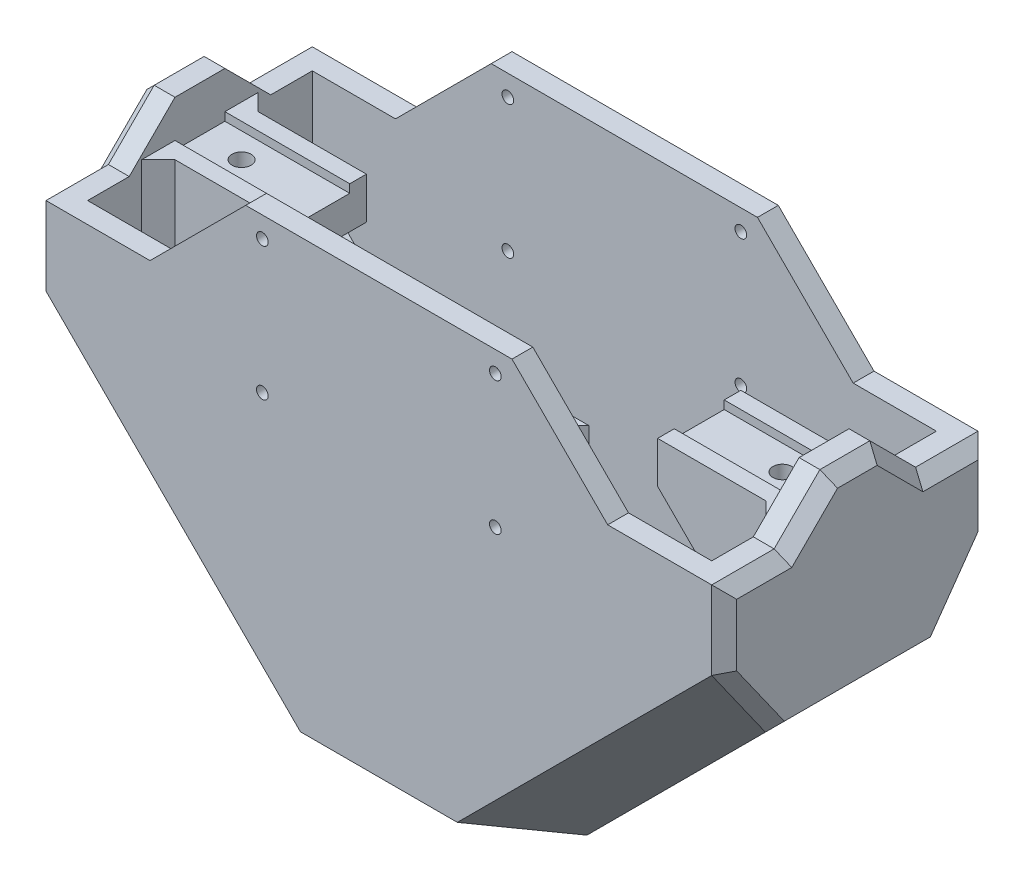
from build123d import *

# Parameters (mm, degrees)
SKETCH1_W                  = 150
SKETCH1_H                  = 54
BOSS_EXTRUDE1_DEPTH        = 75
SHELL1_T                   = 5
BOSS_EXTRUDE2_DEPTH        = 5
BOSS_EXTRUDE3_DEPTH        = 5
SKETCH3_R                  = 1.4
CUT_EXTRUDE1_DEPTH         = 6
BOSS_EXTRUDE4_DEPTH        = 10
SKETCH9_W                  = 30
SKETCH9_H                  = 20
BOSS_EXTRUDE6_DEPTH        = 2
CUT_EXTRUDE2_REACH         = 188.153
SKETCH10_W                 = 12
SKETCH10_H                 = 2
SKETCH11_R                 = 2.3
CUT_EXTRUDE3_DEPTH         = 6
SKETCH13_W                 = 10.5
SKETCH13_H                 = 15
BOSS_EXTRUDE8_DEPTH        = 27
BOSS_EXTRUDE9_DEPTH        = 3.2
CUT_EXTRUDE4_REACH         = 111.024
SKETCH15_R                 = 1.4
CHAMFER8_SIZE              = 0.5
CHAMFER8_OF_MIRROR6_SIZE   = 0.5
CHAMFER3_SIZE              = 40
CHAMFER5_SIZE              = 42.9
CHAMFER9_SIZE              = 5
CHAMFER10_SIZE             = 2
CHAMFER11_SIZE             = 10
CHAMFER12_SIZE             = 12.9
CHAMFER13_SIZE             = 4
BOSS_EXTRUDE10_DEPTH       = 3
CHAMFER14_SIZE             = 3
CHAMFER14_OF_MIRROR28_SIZE = 3


# Some blends are built 0.0001 mm under size
with BuildPart() as part:
    # Sketch1 → Boss-Extrude1 (new body)
    with BuildSketch(Plane(origin=(0, 0, 0), x_dir=(1, 0, 0), z_dir=(0, 1, 0))):
        Rectangle(SKETCH1_W, SKETCH1_H)
    extrude(amount=BOSS_EXTRUDE1_DEPTH)

    # Shell1
    shell1_openings = [part.faces().sort_by_distance(p)[0] for p in [
        (0, 75, 0),
    ]]
    offset(amount=SHELL1_T, openings=shell1_openings, kind=Kind.INTERSECTION)

    # Sketch2 → Boss-Extrude2 (add)
    with BuildSketch(Plane(origin=(80, 0, 0), x_dir=(0, 0, -1), z_dir=(1, 0, 0))):
        Polygon((-17, 75), (-6, 86), (6, 86), (17, 75), align=None)
    boss_extrude2 = extrude(amount=-BOSS_EXTRUDE2_DEPTH)

    # Sketch4 → Boss-Extrude3 (add)
    with BuildSketch(Plane(origin=(0, 0, -32), x_dir=(-1, 0, 0), z_dir=(0, 0, -1))):
        Polygon((-55, 75), (-32, 98), (32, 98), (55, 75), align=None)
    boss_extrude3 = extrude(amount=-BOSS_EXTRUDE3_DEPTH)

    # Sketch3 → Cut-Extrude1 (cut)
    with BuildSketch(Plane(origin=(0, 0, -32), x_dir=(-1, 0, 0), z_dir=(0, 0, -1))):
        with Locations((-28, 93)):
            Circle(SKETCH3_R)
        with Locations((-28, 61)):
            Circle(SKETCH3_R)
        with Locations((28, 93)):
            Circle(SKETCH3_R)
        with Locations((28, 61)):
            Circle(SKETCH3_R)
    cut_extrude1 = extrude(amount=-CUT_EXTRUDE1_DEPTH, mode=Mode.SUBTRACT)

    # Mirror4: Boss-Extrude3, Cut-Extrude1 across plane
    add(boss_extrude3.mirror(Plane.XY))
    add(cut_extrude1.mirror(Plane.XY), mode=Mode.SUBTRACT)

    # Mirror5: Boss-Extrude2 across plane
    add(boss_extrude2.mirror(Plane(origin=(0, 0, 0), x_dir=(0, 0, 1), z_dir=(1, 0, 0))))

    # Sketch5 → Boss-Extrude4 (add, symmetric)
    with BuildSketch(Plane.XY):
        Polygon((-75, 75), (-45, 75), (-45, 67), (-75, 37), align=None)
    boss_extrude4 = extrude(amount=BOSS_EXTRUDE4_DEPTH, both=True)

    # Sketch9 → Boss-Extrude6 (add)
    with BuildSketch(Plane(origin=(0, 75, 0), x_dir=(1, 0, 0), z_dir=(0, 1, 0))):
        with Locations((-60, 0)):
            Rectangle(SKETCH9_W, SKETCH9_H)
    boss_extrude6 = extrude(amount=BOSS_EXTRUDE6_DEPTH)

    # Sketch10 → Cut-Extrude2 (cut, up to next)
    with BuildSketch(Plane(origin=(-75, 0, 0), x_dir=(0, 0, -1), z_dir=(1, 0, 0)), mode=Mode.PRIVATE) as cut_extrude2_sk1:
        with Locations((0, 76)):
            Rectangle(SKETCH10_W, SKETCH10_H)
    cut_extrude2_tool1 = extrude(cut_extrude2_sk1.sketch, amount=CUT_EXTRUDE2_REACH, mode=Mode.PRIVATE) & part.part
    cut_extrude2 = cut_extrude2_tool1.solids().sort_by_distance((-75, 76, 0))[0]
    add(cut_extrude2, mode=Mode.SUBTRACT)

    # Sketch11 → Cut-Extrude3 (cut)
    with BuildSketch(Plane(origin=(0, 75, 0), x_dir=(1, 0, 0), z_dir=(0, 1, 0))):
        with Locations(Location((-65, 0, 0), (0, 0, 270))):
            Circle(SKETCH11_R)
    cut_extrude3 = extrude(amount=-CUT_EXTRUDE3_DEPTH, mode=Mode.SUBTRACT)

    # Mirror24: Boss-Extrude4, Boss-Extrude6, Cut-Extrude2, Cut-Extrude3 across plane
    add(boss_extrude4.mirror(Plane(origin=(0, 0, 0), x_dir=(0, 0, 1), z_dir=(1, 0, 0))))
    add(boss_extrude6.mirror(Plane(origin=(0, 0, 0), x_dir=(0, 0, 1), z_dir=(1, 0, 0))))
    add(cut_extrude2.mirror(Plane(origin=(0, 0, 0), x_dir=(0, 0, 1), z_dir=(1, 0, 0))), mode=Mode.SUBTRACT)
    add(cut_extrude3.mirror(Plane(origin=(0, 0, 0), x_dir=(0, 0, 1), z_dir=(1, 0, 0))), mode=Mode.SUBTRACT)

    # Sketch13 → Boss-Extrude8 (add, symmetric)
    with BuildSketch(Plane.XY):
        with Locations((35.75, 23.7)):
            Rectangle(SKETCH13_W, SKETCH13_H)
        with Locations((-15.75, 23.7)):
            Rectangle(SKETCH13_W, SKETCH13_H)
    extrude(amount=BOSS_EXTRUDE8_DEPTH, both=True)

    # Sketch14 → Boss-Extrude9 (add)
    with BuildSketch(Plane(origin=(0, 31.2, 0), x_dir=(1, 0, 0), z_dir=(0, 1, 0))):
        with BuildLine():
            Line((-10.5, -27), (-10.5, -9.6))
            Line((-10.5, -9.6), (-15.5, -9.6))
            ThreePointArc((-15.5, -9.6), (-16.914213562, -9.014213562), (-17.5, -7.6))
            Line((-17.5, -7.6), (-17.5, 7.6))
            ThreePointArc((-17.5, 7.6), (-16.914213562, 9.014213562), (-15.5, 9.6))
            Line((-15.5, 9.6), (-10.5, 9.6))
            Line((-10.5, 9.6), (-10.5, 27))
            Line((-10.5, 27), (-21, 27))
            Line((-21, 27), (-21, -27))
            Line((-21, -27), (-10.5, -27))
        make_face()
    boss_extrude9 = extrude(amount=BOSS_EXTRUDE9_DEPTH)

    # Sketch15 → Cut-Extrude4 (cut, up to next)
    with BuildSketch(Plane(origin=(0, 31.2, 0), x_dir=(1, 0, 0), z_dir=(0, 1, 0)), mode=Mode.PRIVATE) as cut_extrude4_sk1:
        with Locations(Location((-14.8, 5, 0), (0, 0, 180))):
            Circle(SKETCH15_R)
    cut_extrude4_tool1 = extrude(cut_extrude4_sk1.sketch, amount=-CUT_EXTRUDE4_REACH, mode=Mode.PRIVATE) & part.part
    # Sketch15 → Cut-Extrude4 (cut, up to next)
    with BuildSketch(Plane(origin=(0, 31.2, 0), x_dir=(1, 0, 0), z_dir=(0, 1, 0)), mode=Mode.PRIVATE) as cut_extrude4_sk2:
        with Locations(Location((-14.8, -5, 0), (0, 0, 180))):
            Circle(SKETCH15_R)
    cut_extrude4_tool2 = extrude(cut_extrude4_sk2.sketch, amount=-CUT_EXTRUDE4_REACH, mode=Mode.PRIVATE) & part.part
    cut_extrude4_1 = cut_extrude4_tool1.solids().sort_by_distance((-14.8, 31.2, -5))[0]
    add(cut_extrude4_1, mode=Mode.SUBTRACT)
    cut_extrude4_2 = cut_extrude4_tool2.solids().sort_by_distance((-14.8, 31.2, 5))[0]
    add(cut_extrude4_2, mode=Mode.SUBTRACT)
    cut_extrude4 = cut_extrude4_1 + cut_extrude4_2  # Cut-Extrude4 as one shape, for the pattern or mirror that repeats it

    # Chamfer8
    chamfer8_edges = [part.edges().sort_by_distance(p)[0] for p in [
        (-13.4, 31.2, -5),
        (-13.4, 31.2, 5),
    ]]
    chamfer(chamfer8_edges, length=CHAMFER8_SIZE)

    # Mirror6: Boss-Extrude9, Cut-Extrude4 across plane
    add(boss_extrude9.mirror(Plane(origin=(10, 0, 0), x_dir=(0, 0, 1), z_dir=(1, 0, 0))))
    add(cut_extrude4.mirror(Plane(origin=(10, 0, 0), x_dir=(0, 0, 1), z_dir=(1, 0, 0))), mode=Mode.SUBTRACT)

    # Chamfer8 of Mirror6
    chamfer8_of_mirror6_edges = [part.edges().sort_by_distance(p)[0] for p in [
        (33.4, 31.2, -5),
        (33.4, 31.2, 5),
    ]]
    chamfer(chamfer8_of_mirror6_edges, length=CHAMFER8_OF_MIRROR6_SIZE)

    # Chamfer3
    # the kernel refuses this chamfer: 40 mm, written as the material it adds along each edge
    with BuildSketch(Plane(origin=(75, 0, 27), x_dir=(0.027495876610586317, 0.9996219169112968, 0), z_dir=(0, 0, -1)), Plane(origin=(-75, 0, -27), x_dir=(-0.027495876610586317, 0.9996219169112968, 0), z_dir=(0, 0, 1))) as chamfer3_piece_1:
        Polygon((CHAMFER3_SIZE * 0.999621916911, -CHAMFER3_SIZE * 0.0274958766106), (-CHAMFER3_SIZE * 0.0274958766106, -CHAMFER3_SIZE * 0.999621916911), (0, 0), align=None)
    extrude(amount=54)

    # Chamfer5
    chamfer5_edges = [part.edges().sort_by_distance(p)[0] for p in [
        (-80, -5, 0),
        (80, -5, 0),
    ]]
    chamfer(chamfer5_edges, length=CHAMFER5_SIZE)

    # Chamfer9
    chamfer9_edges = [part.edges().sort_by_distance(p)[0] for p in [
        (35.75, 16.2, -27),
        (35.75, 16.2, 27),
        (-15.75, 16.2, -27),
        (-15.75, 16.2, 27),
    ]]
    chamfer(chamfer9_edges, length=CHAMFER9_SIZE)

    # Chamfer10
    chamfer10_edges = [part.edges().sort_by_distance(p)[0] for p in [
        (30.5, 22.8, -27),
        (41, 22.8, -27),
        (30.5, 22.8, 27),
        (41, 22.8, 27),
        (-10.5, 22.8, 27),
        (-21, 22.8, 27),
        (-10.5, 22.8, -27),
        (-21, 22.8, -27),
    ]]
    chamfer(chamfer10_edges, length=CHAMFER10_SIZE)

    # Chamfer11
    # the kernel refuses this chamfer: 10 mm, written as the material it adds along each edge
    with BuildSketch(Plane(origin=(93.184544799, 58.184544799, 27), x_dir=(-0.7068394360703909, 0.706839436070956, 0.027495876610586303), z_dir=(-0.7071067811868302, -0.7071067811862648, 0))) as chamfer11_piece_1_section:
        Polygon((CHAMFER11_SIZE * 0.999621916911, CHAMFER11_SIZE * 0.0274958766106), (-CHAMFER11_SIZE * 0.0274958766106, CHAMFER11_SIZE * 0.999621916911), (0, 0), align=None)
    chamfer11_piece_1 = extrude(amount=108.002202254, mode=Mode.PRIVATE)
    chamfer11_piece_1 = split(chamfer11_piece_1, bisect_by=Plane(origin=(75, 22.474171504, 23.809556955), z_dir=(-1, 0, 0)), keep=Keep.TOP, mode=Mode.PRIVATE)
    chamfer11_piece_1 = split(chamfer11_piece_1, bisect_by=Plane(origin=(52.525828496, 0, 23.809556955), z_dir=(0, 1, 0)), keep=Keep.TOP, mode=Mode.PRIVATE)
    add(chamfer11_piece_1)
    with BuildSketch(Plane(origin=(93.184544799, 58.184544799, -27), x_dir=(-0.7068394360703909, 0.7068394360709561, -0.027495876610586348), z_dir=(-0.7071067811868302, -0.7071067811862648, 0))) as chamfer11_piece_2_section:
        Polygon((CHAMFER11_SIZE * 0.999621916911, -CHAMFER11_SIZE * 0.0274958766106), (-CHAMFER11_SIZE * 0.0274958766106, -CHAMFER11_SIZE * 0.999621916911), (0, 0), align=None)
    chamfer11_piece_2 = extrude(amount=108.002202254, mode=Mode.PRIVATE)
    chamfer11_piece_2 = split(chamfer11_piece_2, bisect_by=Plane(origin=(75, 22.474171504, -23.809556955), z_dir=(-1, 0, 0)), keep=Keep.TOP, mode=Mode.PRIVATE)
    chamfer11_piece_2 = split(chamfer11_piece_2, bisect_by=Plane(origin=(52.525828496, 0, -23.809556955), z_dir=(0, 1, 0)), keep=Keep.TOP, mode=Mode.PRIVATE)
    add(chamfer11_piece_2)
    with BuildSketch(Plane(origin=(-93.184544799, 58.184544799, -27), x_dir=(0.7068394360703909, 0.706839436070956, -0.027495876610586303), z_dir=(0.7071067811868302, -0.7071067811862648, 0))) as chamfer11_piece_3_section:
        Polygon((CHAMFER11_SIZE * 0.999621916911, CHAMFER11_SIZE * 0.0274958766106), (-CHAMFER11_SIZE * 0.0274958766106, CHAMFER11_SIZE * 0.999621916911), (0, 0), align=None)
    chamfer11_piece_3 = extrude(amount=108.002202254, mode=Mode.PRIVATE)
    chamfer11_piece_3 = split(chamfer11_piece_3, bisect_by=Plane(origin=(-75, 22.474171504, -23.809556955), z_dir=(1, 0, 0)), keep=Keep.TOP, mode=Mode.PRIVATE)
    chamfer11_piece_3 = split(chamfer11_piece_3, bisect_by=Plane(origin=(-52.525828496, 0, -23.809556955), z_dir=(0, 1, 0)), keep=Keep.TOP, mode=Mode.PRIVATE)
    add(chamfer11_piece_3)
    with BuildSketch(Plane(origin=(-93.184544799, 58.184544799, 27), x_dir=(0.7068394360703909, 0.7068394360709561, 0.027495876610586334), z_dir=(0.7071067811868302, -0.7071067811862648, 0))) as chamfer11_piece_4_section:
        Polygon((CHAMFER11_SIZE * 0.999621916911, -CHAMFER11_SIZE * 0.0274958766106), (-CHAMFER11_SIZE * 0.0274958766106, -CHAMFER11_SIZE * 0.999621916911), (0, 0), align=None)
    chamfer11_piece_4 = extrude(amount=108.002202254, mode=Mode.PRIVATE)
    chamfer11_piece_4 = split(chamfer11_piece_4, bisect_by=Plane(origin=(-75, 22.474171504, 23.809556955), z_dir=(1, 0, 0)), keep=Keep.TOP, mode=Mode.PRIVATE)
    chamfer11_piece_4 = split(chamfer11_piece_4, bisect_by=Plane(origin=(-52.525828496, 0, 23.809556955), z_dir=(0, 1, 0)), keep=Keep.TOP, mode=Mode.PRIVATE)
    add(chamfer11_piece_4)

    # Chamfer12
    chamfer12_edges = [part.edges().sort_by_distance(p)[0] for p in [
        (-58.55, 16.45, -32),
        (58.55, 16.45, -32),
        (-58.55, 16.45, 32),
        (58.55, 16.45, 32),
    ]]
    chamfer(chamfer12_edges, length=CHAMFER12_SIZE)

    # Chamfer13
    # the kernel refuses this chamfer: 4 mm, written as the material it adds along each edge
    with BuildSketch(Plane(origin=(-75, 29.713268048, 10), x_dir=(-0.027495876610585623, 0, 0.9996219169112968), z_dir=(0, 1, 0))) as chamfer13_piece_1_section:
        Polygon((CHAMFER13_SIZE * 0.999621916911, CHAMFER13_SIZE * 0.0274958766106), (-CHAMFER13_SIZE * 0.0274958766106, CHAMFER13_SIZE * 0.999621916911), (0, 0), align=None)
    chamfer13_piece_1 = extrude(amount=47.286731952, mode=Mode.PRIVATE)
    chamfer13_piece_1 = split(chamfer13_piece_1, bisect_by=Plane(origin=(-63.755995162, 48.244004838, 11.33377678), z_dir=(-0.7071067811865515, 0.7071067811865436, 0)), keep=Keep.TOP, mode=Mode.PRIVATE)
    add(chamfer13_piece_1)
    with BuildSketch(Plane(origin=(-75, 77, -10), x_dir=(-0.027495876610737532, 0, -0.9996219169112927), z_dir=(0, -1, 0))) as chamfer13_piece_2_section:
        Polygon((CHAMFER13_SIZE * 0.999621916911, CHAMFER13_SIZE * 0.0274958766106), (-CHAMFER13_SIZE * 0.0274958766107, CHAMFER13_SIZE * 0.999621916911), (0, 0), align=None)
    chamfer13_piece_2 = extrude(amount=47.286731952, mode=Mode.PRIVATE)
    chamfer13_piece_2 = split(chamfer13_piece_2, bisect_by=Plane(origin=(-63.755995162, 48.244004838, -11.33377678), z_dir=(-0.7071067811865515, 0.7071067811865436, 0)), keep=Keep.TOP, mode=Mode.PRIVATE)
    add(chamfer13_piece_2)
    with BuildSketch(Plane(origin=(75, 77, 10), x_dir=(0.02749587661043717, 0, 0.9996219169113009), z_dir=(0, -1, 0))) as chamfer13_piece_3_section:
        Polygon((CHAMFER13_SIZE * 0.999621916911, CHAMFER13_SIZE * 0.0274958766106), (-CHAMFER13_SIZE * 0.0274958766104, CHAMFER13_SIZE * 0.999621916911), (0, 0), align=None)
    chamfer13_piece_3 = extrude(amount=47.286731952, mode=Mode.PRIVATE)
    chamfer13_piece_3 = split(chamfer13_piece_3, bisect_by=Plane(origin=(63.755995162, 48.244004838, 11.33377678), z_dir=(0.7071067811865515, 0.7071067811865436, 0)), keep=Keep.TOP, mode=Mode.PRIVATE)
    add(chamfer13_piece_3)
    with BuildSketch(Plane(origin=(75, 29.713268048, -10), x_dir=(0.027495876610585623, 0, -0.9996219169112968), z_dir=(0, 1, 0))) as chamfer13_piece_4_section:
        Polygon((CHAMFER13_SIZE * 0.999621916911, CHAMFER13_SIZE * 0.0274958766106), (-CHAMFER13_SIZE * 0.0274958766106, CHAMFER13_SIZE * 0.999621916911), (0, 0), align=None)
    chamfer13_piece_4 = extrude(amount=47.286731952, mode=Mode.PRIVATE)
    chamfer13_piece_4 = split(chamfer13_piece_4, bisect_by=Plane(origin=(63.755995162, 48.244004838, -11.33377678), z_dir=(0.7071067811865515, 0.7071067811865436, 0)), keep=Keep.TOP, mode=Mode.PRIVATE)
    add(chamfer13_piece_4)

    # Sketch16 → Boss-Extrude10 (add)
    with BuildSketch(Plane(origin=(80, 0, 0), x_dir=(0, 0, -1), z_dir=(1, 0, 0))):
        Polygon((-19.1, 37.9), (19.1, 37.9), (32, 56.143354955), (32, 75), (17, 75), (6, 86), (-6, 86), (-17, 75), (-32, 75), (-32, 56.143354955), align=None)
    boss_extrude10 = extrude(amount=BOSS_EXTRUDE10_DEPTH)

    # Chamfer14
    chamfer14_edges = [part.edges().sort_by_distance(p)[0] for p in [
        (83, 65.571677477, 32),
        (83, 75, 24.5),
        (83, 80.5, 11.5),
        (83, 86, 0),
        (83, 80.5, -11.5),
        (83, 75, -24.5),
        (83, 65.571677477, -32),
        (83, 47.021677477, -25.55),
        (83, 37.9, 0),
        (83, 47.021677477, 25.55),
    ]]
    chamfer(chamfer14_edges, length=CHAMFER14_SIZE - 0.0001)  # a hair under: the kernel refuses the full size

    # Mirror28: Boss-Extrude10 across plane
    add(boss_extrude10.mirror(Plane(origin=(0, 0, 0), x_dir=(0, 0, 1), z_dir=(1, 0, 0))))

    # Chamfer14 of Mirror28
    chamfer14_of_mirror28_edges = [part.edges().sort_by_distance(p)[0] for p in [
        (-83, 65.571677477, 32),
        (-83, 75, 24.5),
        (-83, 80.5, 11.5),
        (-83, 86, 0),
        (-83, 80.5, -11.5),
        (-83, 75, -24.5),
        (-83, 65.571677477, -32),
        (-83, 47.021677477, -25.55),
        (-83, 37.9, 0),
        (-83, 47.021677477, 25.55),
    ]]
    chamfer(chamfer14_of_mirror28_edges, length=CHAMFER14_OF_MIRROR28_SIZE - 0.0001)  # a hair under: the kernel refuses the full size


solid = part.part
